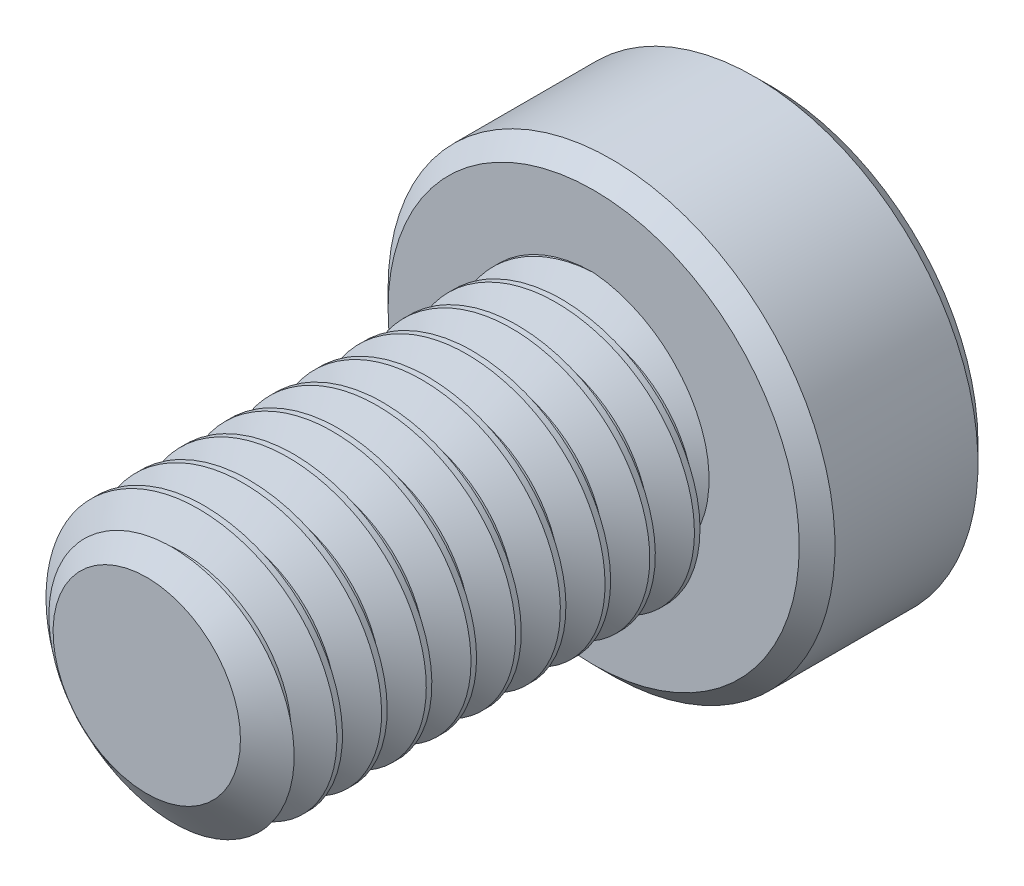
from build123d import *

# Parameters (mm, degrees)
SKETCH1_R          = 3
EXTRUDE1_DEPTH     = 10
CUT_SWEEP1_PITCH   = 1
SKETCH6_R          = 5
EXTRUDE2_DEPTH     = 4
CUT_EXTRUDE1_DEPTH = 3
CHAMFER1_SIZE      = 0.4


with BuildPart() as part:
    # Sketch1 → Extrude1 (new body)
    with BuildSketch(Plane.XY):
        Circle(SKETCH1_R)
    extrude(amount=-EXTRUDE1_DEPTH)

    # Cut-Sweep1: the profile of Sketch3 profile screwed along a right-hand helix of 11 turns, 6 arcs to a turn; built about Z, then put on its axis
    cut_sweep1_z = Axis((0, 0, 0), (0, 0, 1))
    cut_sweep1_corners = [(3.0003, 0, -0.875173205), (2.350480947, 0, -0.5), (2.350480947, 0, -0.375), (3.0003, 0, 0.000173205)]
    with BuildLine(mode=Mode.PRIVATE) as cut_sweep1_profile:
        Line(cut_sweep1_corners[0], cut_sweep1_corners[1])
        Line(cut_sweep1_corners[1], cut_sweep1_corners[2])
        Line(cut_sweep1_corners[2], cut_sweep1_corners[3])
        Line(cut_sweep1_corners[3], cut_sweep1_corners[0])
    cut_sweep1_cap = Face(cut_sweep1_profile.wire())
    cut_sweep1_turn_angles = [0, 30, 60, 90, 120, 150, 180, 210, 240, 270, 300, 330, 360]
    cut_sweep1_turn_weights = [1, 0.8660254037844387, 1, 0.8660254037844387, 1, 0.8660254037844387, 1, 0.8660254037844387, 1, 0.8660254037844387, 1, 0.8660254037844387, 1]
    cut_sweep1_turn_rails = [Edge.make_bspline([Vector(p[0], p[1], 0).rotate(cut_sweep1_z, cut_sweep1_turn_angles[k]) / cut_sweep1_turn_weights[k] + Vector(0, 0, p[2] + CUT_SWEEP1_PITCH * cut_sweep1_turn_angles[k] / 360) for k in range(13)], [0, 0, 0, 1, 1, 2, 2, 3, 3, 4, 4, 5, 5, 6, 6, 6], 2, cut_sweep1_turn_weights) for p in cut_sweep1_corners]
    cut_sweep1_turn_sides = [Face.make_surface_from_curves(cut_sweep1_turn_rails[p[0]], cut_sweep1_turn_rails[p[1]]) for p in [(0, 1), (1, 2), (2, 3), (3, 0)]]
    cut_sweep1 = Plane(origin=(0, 0, 0), x_dir=(0, 1, 0), z_dir=(0, 0, -1)) * Solid(Shell([*[p.moved(Location((0, 0, CUT_SWEEP1_PITCH * i))) for i in range(11) for p in cut_sweep1_turn_sides], cut_sweep1_cap, cut_sweep1_cap.rotate(cut_sweep1_z, 3960).moved(Location((0, 0, CUT_SWEEP1_PITCH * 3960 / 360)))]))
    add(cut_sweep1, mode=Mode.SUBTRACT)

    # Sketch4 → Cut-Revolve1 (revolve, cut)
    with BuildSketch(Plane(origin=(0, 0, 0), x_dir=(0, 0, -1), z_dir=(1, 0, 0)), mode=Mode.PRIVATE) as cut_revolve1_sk:
        Polygon((0.632650852, 3), (0, 2.096480947), (0, 3), align=None)
    revolve(cut_revolve1_sk.sketch.rotate(Axis((0, 0, 0), (0, 0, -1)), 244.349292568), axis=Axis((0, 0, 0), (0, 0, -1)), mode=Mode.SUBTRACT)

    # Sketch6 → Extrude2 (add)
    with BuildSketch(Plane(origin=(0, 0, -10), x_dir=(-1, 0, 0), z_dir=(0, 0, -1))):
        Circle(SKETCH6_R)
    extrude(amount=EXTRUDE2_DEPTH)

    # Sketch7 → Cut-Extrude1 (cut)
    with BuildSketch(Plane(origin=(0, 0, -14), x_dir=(-1, 0, 0), z_dir=(0, 0, -1))):
        Polygon((0, 2.309401077), (-2, 1.154700538), (-2, -1.154700538), (0, -2.309401077), (2, -1.154700538), (2, 1.154700538), align=None)
    extrude(amount=-CUT_EXTRUDE1_DEPTH, mode=Mode.SUBTRACT)

    # Cut-Extrude2 cone 1 section (through the dimple's axis) → Cut-Extrude2 (revolve, cut)
    with BuildSketch(Plane(origin=(0, 0, -14), x_dir=(0, 1, 0), z_dir=(1, 0, 0))):
        Polygon((0, 0), (2.309401077, 0), (0, 2.309401077), align=None)
    revolve(axis=Axis((0, 0, -14), (0, 0, 1)), mode=Mode.SUBTRACT)

    # Chamfer1
    chamfer1_edges = [part.edges().sort_by_distance(p)[0] for p in [
        (5, 0, -10),
        (5, 0, -14),
    ]]
    chamfer(chamfer1_edges, length=CHAMFER1_SIZE)


solid = part.part
